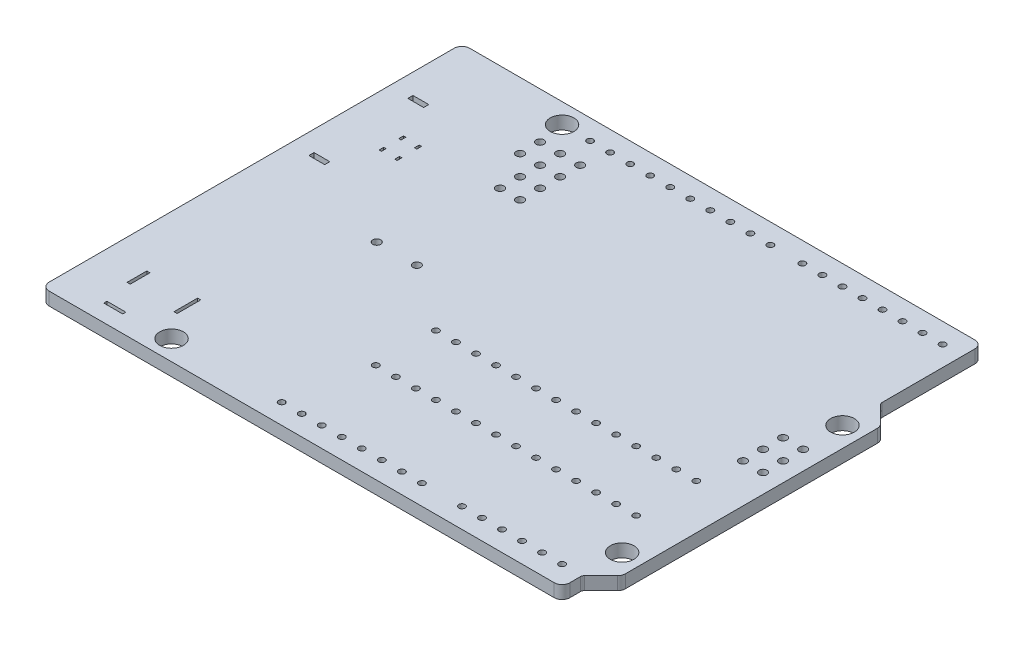
from build123d import *

# Parameters (mm, degrees)
SKETCH1_R           = 1.5
BOSS_EXTRUDE1_DEPTH = 1.65
FILLET1_R           = 1
FILLET2_R           = 0.5
SKETCH2_R           = 0.4
CUT_EXTRUDE1_DEPTH  = 87.897033896
LPATTERN1_COUNT     = 15
LPATTERN1_PITCH     = 2.54
SKETCH3_R           = 0.4
CUT_EXTRUDE2_DEPTH  = 87.897033896
LPATTERN2_COUNT     = 10
LPATTERN2_PITCH     = 2.54
SKETCH4_R           = 0.4
CUT_EXTRUDE3_DEPTH  = 87.897033896
LPATTERN3_COUNT     = 8
LPATTERN3_PITCH     = 2.54
SKETCH5_R           = 0.5
CUT_EXTRUDE4_DEPTH  = 87.897033896
SKETCH6_R           = 0.4
CUT_EXTRUDE5_DEPTH  = 87.897033896
INDENT1_START       = 11.17
INDENT1_OUTLINE_W   = 1.65
INDENT1_OUTLINE_H   = 3
INDENT1_DEPTH       = 0.4
INDENT1_START_2     = 4.97
INDENT1_2_OUTLINE_W = 1.65
INDENT1_2_OUTLINE_H = 2.5
INDENT1_2_DEPTH     = 0.4
INDENT1_START_3     = 5.77
INDENT1_3_OUTLINE_W = 1.65
INDENT1_3_OUTLINE_H = 0.4
INDENT1_3_DEPTH     = 2.4
INDENT2_START       = 2.57
INDENT2_OUTLINE_W   = 1.65
INDENT2_OUTLINE_H   = 0.65
INDENT2_DEPTH       = 2
INDENT2_START_2     = 6.41
INDENT2_2_OUTLINE_W = 1.65
INDENT2_2_OUTLINE_H = 0.6
INDENT2_2_DEPTH     = 0.3
INDENT2_START_3     = 8.41
INDENT2_3_OUTLINE_W = 1.65
INDENT2_3_OUTLINE_H = 0.6
INDENT2_3_DEPTH     = 0.3
INDENT3_START       = 6.41
INDENT3_OUTLINE_W   = 1.65
INDENT3_OUTLINE_H   = 0.6
INDENT3_DEPTH       = 0.3
INDENT3_START_2     = 8.41
INDENT3_2_OUTLINE_W = 1.65
INDENT3_2_OUTLINE_H = 0.6
INDENT3_2_DEPTH     = 0.3


# Read off the part's stored shape, not the designer's step: Indent1, Indent2, Indent3
with BuildPart() as part:
    # Sketch1 → Boss-Extrude1 (new body)
    with BuildSketch(Plane(origin=(0, 0, 0), x_dir=(1, 0, 0), z_dir=(0, 1, 0))):
        Polygon((0, 0), (66.04, 0), (66.04, 2.54), (68.58, 5.08), (68.58, 37.85), (66.04, 40.39), (66.04, 53.34), (0, 53.34), align=None)
        with Locations(Location((15.24, 50.8, 0), (0, 0, 270))):
            Circle(SKETCH1_R, mode=Mode.SUBTRACT)
        with Locations(Location((66.04, 7.62, 0), (0, 0, 270))):
            Circle(SKETCH1_R, mode=Mode.SUBTRACT)
        with Locations(Location((13.97, 2.54, 0), (0, 0, 270))):
            Circle(SKETCH1_R, mode=Mode.SUBTRACT)
        with Locations(Location((66.04, 35.56, 0), (0, 0, 270))):
            Circle(SKETCH1_R, mode=Mode.SUBTRACT)
    extrude(amount=-BOSS_EXTRUDE1_DEPTH)

    # Fillet1
    fillet1_edges = [part.edges().sort_by_distance(p)[0] for p in [
        (0, -0.825, -53.34),
        (66.04, -0.825, -53.34),
        (68.58, -0.825, -37.85),
        (68.58, -0.825, -5.08),
        (66.04, -0.825, 0),
        (0, -0.825, 0),
    ]]
    fillet(fillet1_edges, radius=FILLET1_R)

    # Fillet2
    fillet2_edges = [part.edges().sort_by_distance(p)[0] for p in [
        (66.04, -0.825, -40.39),
        (66.04, -0.825, -2.54),
    ]]
    fillet(fillet2_edges, radius=FILLET2_R)

    # Sketch2 → Cut-Extrude1 (cut, through all)
    with BuildSketch(Plane(origin=(0, 0, 0), x_dir=(1, 0, 0), z_dir=(0, 1, 0))):
        with Locations(Location((27.94, 2.54, 0), (0, 0, 270))):
            Circle(SKETCH2_R)
    cut_extrude1 = extrude(amount=-CUT_EXTRUDE1_DEPTH, mode=Mode.SUBTRACT)

    # LPattern1: Cut-Extrude1 ×15, 1 skipped
    with Locations(*[(i * LPATTERN1_PITCH, 0, 0) for i in range(1, LPATTERN1_COUNT) if i not in (8,)]):
        add(cut_extrude1, mode=Mode.SUBTRACT)

    # Sketch3 → Cut-Extrude2 (cut, through all)
    with BuildSketch(Plane(origin=(0, 0, 0), x_dir=(1, 0, 0), z_dir=(0, 1, 0))):
        with Locations(Location((18.8, 50.8, 0), (0, 0, 270))):
            Circle(SKETCH3_R)
    cut_extrude2 = extrude(amount=-CUT_EXTRUDE2_DEPTH, mode=Mode.SUBTRACT)

    # LPattern2: Cut-Extrude2 ×10
    with Locations(*[(i * LPATTERN2_PITCH, 0, 0) for i in range(1, LPATTERN2_COUNT)]):
        add(cut_extrude2, mode=Mode.SUBTRACT)

    # Sketch4 → Cut-Extrude3 (cut, through all)
    with BuildSketch(Plane(origin=(0, 0, 0), x_dir=(1, 0, 0), z_dir=(0, 1, 0))):
        with Locations(Location((45.72, 50.8, 0), (0, 0, 270))):
            Circle(SKETCH4_R)
    cut_extrude3 = extrude(amount=-CUT_EXTRUDE3_DEPTH, mode=Mode.SUBTRACT)

    # LPattern3: Cut-Extrude3 ×8
    with Locations(*[(i * LPATTERN3_PITCH, 0, 0) for i in range(1, LPATTERN3_COUNT)]):
        add(cut_extrude3, mode=Mode.SUBTRACT)

    # Sketch5 → Cut-Extrude4 (cut, through all)
    with BuildSketch(Plane(origin=(0, 0, 0), x_dir=(1, 0, 0), z_dir=(0, 1, 0))):
        with Locations(Location((15.75, 47.5, 0), (0, 0, 270))):
            Circle(SKETCH5_R)
        with Locations(Location((18.29, 47.5, 0), (0, 0, 270))):
            Circle(SKETCH5_R)
        with Locations(Location((20.83, 47.5, 0), (0, 0, 270))):
            Circle(SKETCH5_R)
        with Locations(Location((15.75, 44.96, 0), (0, 0, 270))):
            Circle(SKETCH5_R)
        with Locations(Location((18.29, 44.96, 0), (0, 0, 270))):
            Circle(SKETCH5_R)
        with Locations(Location((20.83, 44.96, 0), (0, 0, 270))):
            Circle(SKETCH5_R)
        with Locations(Location((18.29, 42.42, 0), (0, 0, 270))):
            Circle(SKETCH5_R)
        with Locations(Location((20.83, 42.42, 0), (0, 0, 270))):
            Circle(SKETCH5_R)
        with Locations(Location((18.29, 39.88, 0), (0, 0, 270))):
            Circle(SKETCH5_R)
        with Locations(Location((20.83, 39.88, 0), (0, 0, 270))):
            Circle(SKETCH5_R)
        with Locations(Location((16.38, 26.16, 0), (0, 0, 270))):
            Circle(SKETCH5_R)
        with Locations(Location((21.46, 26.16, 0), (0, 0, 270))):
            Circle(SKETCH5_R)
        with Locations(Location((63.64, 30.43, 0), (0, 0, 270))):
            Circle(SKETCH5_R)
        with Locations(Location((63.64, 27.89, 0), (0, 0, 270))):
            Circle(SKETCH5_R)
        with Locations(Location((63.64, 25.35, 0), (0, 0, 270))):
            Circle(SKETCH5_R)
        with Locations(Location((66.18, 25.35, 0), (0, 0, 270))):
            Circle(SKETCH5_R)
        with Locations(Location((66.18, 27.89, 0), (0, 0, 270))):
            Circle(SKETCH5_R)
        with Locations(Location((66.18, 30.43, 0), (0, 0, 270))):
            Circle(SKETCH5_R)
    extrude(amount=-CUT_EXTRUDE4_DEPTH, mode=Mode.SUBTRACT)

    # Sketch6 → Cut-Extrude5 (cut, through all)
    with BuildSketch(Plane(origin=(0, 0, 0), x_dir=(1, 0, 0), z_dir=(0, 1, 0))):
        with Locations(Location((29.85, 12.57, 0), (0, 0, 270))):
            Circle(SKETCH6_R)
        with Locations(Location((32.39, 12.57, 0), (0, 0, 270))):
            Circle(SKETCH6_R)
        with Locations(Location((34.93, 12.57, 0), (0, 0, 270))):
            Circle(SKETCH6_R)
        with Locations(Location((37.47, 12.57, 0), (0, 0, 270))):
            Circle(SKETCH6_R)
        with Locations(Location((40.01, 12.57, 0), (0, 0, 270))):
            Circle(SKETCH6_R)
        with Locations(Location((42.55, 12.57, 0), (0, 0, 270))):
            Circle(SKETCH6_R)
        with Locations(Location((45.09, 12.57, 0), (0, 0, 270))):
            Circle(SKETCH6_R)
        with Locations(Location((47.63, 12.57, 0), (0, 0, 270))):
            Circle(SKETCH6_R)
        with Locations(Location((50.17, 12.57, 0), (0, 0, 270))):
            Circle(SKETCH6_R)
        with Locations(Location((52.71, 12.57, 0), (0, 0, 270))):
            Circle(SKETCH6_R)
        with Locations(Location((55.25, 12.57, 0), (0, 0, 270))):
            Circle(SKETCH6_R)
        with Locations(Location((57.79, 12.57, 0), (0, 0, 270))):
            Circle(SKETCH6_R)
        with Locations(Location((60.33, 12.57, 0), (0, 0, 270))):
            Circle(SKETCH6_R)
        with Locations(Location((62.87, 12.57, 0), (0, 0, 270))):
            Circle(SKETCH6_R)
        with Locations(Location((29.85, 20.19, 0), (0, 0, 270))):
            Circle(SKETCH6_R)
        with Locations(Location((32.39, 20.19, 0), (0, 0, 270))):
            Circle(SKETCH6_R)
        with Locations(Location((34.93, 20.19, 0), (0, 0, 270))):
            Circle(SKETCH6_R)
        with Locations(Location((37.47, 20.19, 0), (0, 0, 270))):
            Circle(SKETCH6_R)
        with Locations(Location((40.01, 20.19, 0), (0, 0, 270))):
            Circle(SKETCH6_R)
        with Locations(Location((42.55, 20.19, 0), (0, 0, 270))):
            Circle(SKETCH6_R)
        with Locations(Location((45.09, 20.19, 0), (0, 0, 270))):
            Circle(SKETCH6_R)
        with Locations(Location((47.63, 20.19, 0), (0, 0, 270))):
            Circle(SKETCH6_R)
        with Locations(Location((50.17, 20.19, 0), (0, 0, 270))):
            Circle(SKETCH6_R)
        with Locations(Location((52.71, 20.19, 0), (0, 0, 270))):
            Circle(SKETCH6_R)
        with Locations(Location((55.25, 20.19, 0), (0, 0, 270))):
            Circle(SKETCH6_R)
        with Locations(Location((57.79, 20.19, 0), (0, 0, 270))):
            Circle(SKETCH6_R)
        with Locations(Location((60.33, 20.19, 0), (0, 0, 270))):
            Circle(SKETCH6_R)
        with Locations(Location((62.87, 20.19, 0), (0, 0, 270))):
            Circle(SKETCH6_R)
    extrude(amount=-CUT_EXTRUDE5_DEPTH, mode=Mode.SUBTRACT)

    # Indent1 outline → Indent1 (cut)
    with BuildSketch(Plane.YZ.offset(INDENT1_START)):
        with Locations((-0.825, -7.15)):
            Rectangle(INDENT1_OUTLINE_W, INDENT1_OUTLINE_H)
    extrude(amount=INDENT1_DEPTH, mode=Mode.SUBTRACT)

    # Indent1 2 outline → Indent1 2 (cut)
    with BuildSketch(Plane.YZ.offset(INDENT1_START_2)):
        with Locations((-0.825, -7.15)):
            Rectangle(INDENT1_2_OUTLINE_W, INDENT1_2_OUTLINE_H)
    extrude(amount=INDENT1_2_DEPTH, mode=Mode.SUBTRACT)

    # Indent1 3 outline → Indent1 3 (cut)
    with BuildSketch(Plane.YZ.offset(INDENT1_START_3)):
        with Locations((-0.825, -2.35)):
            Rectangle(INDENT1_3_OUTLINE_W, INDENT1_3_OUTLINE_H)
    extrude(amount=INDENT1_3_DEPTH, mode=Mode.SUBTRACT)

    # Indent2 outline → Indent2 (cut)
    with BuildSketch(Plane.YZ.offset(INDENT2_START)):
        with Locations((-0.825, -31.685)):
            Rectangle(INDENT2_OUTLINE_W, INDENT2_OUTLINE_H)
        with Locations((-0.825, -44.235)):
            Rectangle(INDENT2_OUTLINE_W, INDENT2_OUTLINE_H)
    extrude(amount=INDENT2_DEPTH, mode=Mode.SUBTRACT)

    # Indent2 2 outline → Indent2 2 (cut)
    with BuildSketch(Plane.YZ.offset(INDENT2_START_2)):
        with Locations((-0.825, -36.71)):
            Rectangle(INDENT2_2_OUTLINE_W, INDENT2_2_OUTLINE_H)
    extrude(amount=INDENT2_2_DEPTH, mode=Mode.SUBTRACT)

    # Indent2 3 outline → Indent2 3 (cut)
    with BuildSketch(Plane.YZ.offset(INDENT2_START_3)):
        with Locations((-0.825, -36.71)):
            Rectangle(INDENT2_3_OUTLINE_W, INDENT2_3_OUTLINE_H)
    extrude(amount=INDENT2_3_DEPTH, mode=Mode.SUBTRACT)

    # Indent3 outline → Indent3 (cut)
    with BuildSketch(Plane.YZ.offset(INDENT3_START)):
        with Locations((-0.825, -39.21)):
            Rectangle(INDENT3_OUTLINE_W, INDENT3_OUTLINE_H)
    extrude(amount=INDENT3_DEPTH, mode=Mode.SUBTRACT)

    # Indent3 2 outline → Indent3 2 (cut)
    with BuildSketch(Plane.YZ.offset(INDENT3_START_2)):
        with Locations((-0.825, -39.21)):
            Rectangle(INDENT3_2_OUTLINE_W, INDENT3_2_OUTLINE_H)
    extrude(amount=INDENT3_2_DEPTH, mode=Mode.SUBTRACT)


solid = part.part
